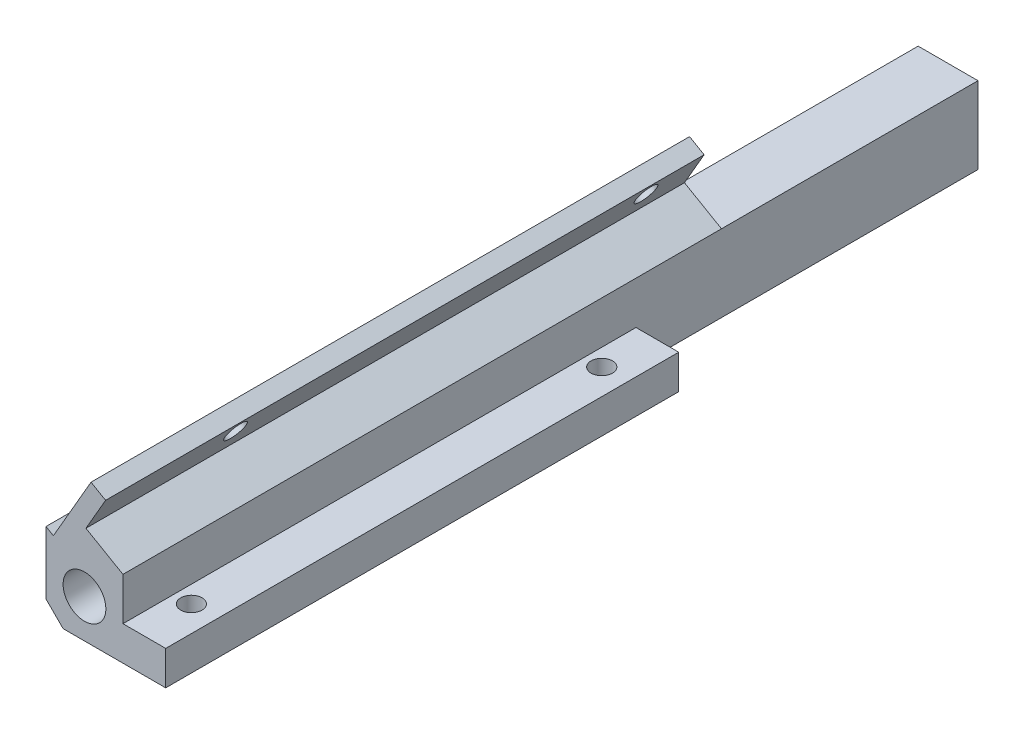
from build123d import *

# Parameters (mm, degrees)
SKETCH1_W           = 77.47
SKETCH1_H           = 127
BOSS_EXTRUDE1_DEPTH = 11.43
SKETCH2_R           = 3.175
CUT_EXTRUDE1_DEPTH  = 150.202030147
CUT_EXTRUDE2_DEPTH  = 150.202030147
SKETCH4_W           = 54.61
SKETCH4_H           = 6.35
CUT_EXTRUDE3_DEPTH  = 150.202030147
CHAMFER1_SIZE       = 2.54
CUT_EXTRUDE4_DEPTH  = 150.202030147
SKETCH6_W           = 53.34
SKETCH6_H           = 76.2
CUT_EXTRUDE5_DEPTH  = 150.202030147
SKETCH7_R           = 1.5875
CUT_EXTRUDE6_DEPTH  = 130.427892666
BOSS_EXTRUDE5_DEPTH = 88.9
SKETCH18_W          = 6.35
SKETCH18_H          = 5.08
CUT_EXTRUDE13_DEPTH = 76.2
CUT_EXTRUDE15_REACH = 132.131
SKETCH19_R          = 1.5875
SKETCH20_W          = 88.9
SKETCH20_H          = 11.176
CUT_EXTRUDE16_DEPTH = 1.27


with BuildPart() as part:
    # Sketch1 → Boss-Extrude1 (new body)
    with BuildSketch(Plane(origin=(0, 0, 0), x_dir=(1, 0, 0), z_dir=(0, 1, 0))):
        with Locations((38.735, 63.5)):
            Rectangle(SKETCH1_W, SKETCH1_H)
    extrude(amount=BOSS_EXTRUDE1_DEPTH)

    # Sketch2 → Cut-Extrude1 (cut, through all)
    with BuildSketch(Plane.XY):
        with Locations((5.715, 5.715)):
            Circle(SKETCH2_R)
        with Locations((71.755, 5.715)):
            Circle(SKETCH2_R)
    extrude(amount=-CUT_EXTRUDE1_DEPTH, mode=Mode.SUBTRACT)

    # Sketch3 → Cut-Extrude2 (cut, through all)
    with BuildSketch(Plane(origin=(0, 11.43, 0), x_dir=(1, 0, 0), z_dir=(0, 1, 0))):
        with BuildLine():
            Line((11.43, 127), (11.43, 88.9))
            ThreePointArc((11.43, 88.9), (15.149743879, 79.919743879), (24.13, 76.2))
            Line((24.13, 76.2), (53.34, 76.2))
            ThreePointArc((53.34, 76.2), (62.320256121, 79.919743879), (66.04, 88.9))
            Line((66.04, 88.9), (66.04, 127))
            Line((66.04, 127), (11.43, 127))
        make_face()
    extrude(amount=-CUT_EXTRUDE2_DEPTH, mode=Mode.SUBTRACT)

    # Sketch4 → Cut-Extrude3 (cut, through all)
    with BuildSketch(Plane(origin=(0, 0, -127), x_dir=(-1, 0, 0), z_dir=(0, 0, -1))):
        with Locations((-38.735, 8.255)):
            Rectangle(SKETCH4_W, SKETCH4_H)
    extrude(amount=-CUT_EXTRUDE3_DEPTH, mode=Mode.SUBTRACT)

    # Chamfer1
    chamfer1_edges = [part.edges().sort_by_distance(p)[0] for p in [
        (0, 0, -63.5),
        (0, 11.43, -63.5),
        (77.47, 0, -63.5),
        (77.47, 11.43, -63.5),
    ]]
    chamfer(chamfer1_edges, length=CHAMFER1_SIZE)

    # Sketch5 → Cut-Extrude4 (cut, through all)
    with BuildSketch(Plane(origin=(0, 11.43, 0), x_dir=(1, 0, 0), z_dir=(0, 1, 0))):
        Polygon((11.43, 88.9), (11.43, 76.2), (77.47, 76.2), (77.47, 127), (11.43, 127), align=None)
    extrude(amount=-CUT_EXTRUDE4_DEPTH, mode=Mode.SUBTRACT)

    # Sketch6 → Cut-Extrude5 (cut, through all)
    with BuildSketch(Plane(origin=(0, 11.43, 0), x_dir=(1, 0, 0), z_dir=(0, 1, 0))):
        with Locations((50.8, 38.1)):
            Rectangle(SKETCH6_W, SKETCH6_H)
    extrude(amount=-CUT_EXTRUDE5_DEPTH, mode=Mode.SUBTRACT)

    # Sketch7 → Cut-Extrude6 (cut, through all)
    with BuildSketch(Plane(origin=(0, 5.08, 0), x_dir=(1, 0, 0), z_dir=(0, 1, 0))):
        with Locations((13.97, 68.58)):
            Circle(SKETCH7_R)
        with Locations((13.97, 7.62)):
            Circle(SKETCH7_R)
    extrude(amount=-CUT_EXTRUDE6_DEPTH, mode=Mode.SUBTRACT)

    # Sketch17 → Boss-Extrude5 (add)
    with BuildSketch(Plane.XY):
        Polygon((0, 8.89), (0, 11.869940905), (5.588, 21.548640818), (8.851738686, 19.664320409), (5.930738686, 14.605), (11.43, 11.43), (2.54, 11.43), align=None)
    extrude(amount=-BOSS_EXTRUDE5_DEPTH)

    # Sketch18 → Cut-Extrude13 (cut)
    with BuildSketch(Plane.XY):
        with Locations((20.955, 2.54)):
            Rectangle(SKETCH18_W, SKETCH18_H)
    extrude(amount=-CUT_EXTRUDE13_DEPTH, mode=Mode.SUBTRACT)

    # Sketch19 → Cut-Extrude15 (cut, up to next)
    with BuildSketch(Plane(origin=(-1.876096497, 1.083164817, 0), x_dir=(0, 0, -1), z_dir=(0.8660254037844363, -0.5000000000000043, 0)), mode=Mode.PRIVATE) as cut_extrude15_sk1:
        with Locations((20.32, 19.423670365)):
            Circle(SKETCH19_R)
    cut_extrude15_tool1 = extrude(cut_extrude15_sk1.sketch, amount=-CUT_EXTRUDE15_REACH, mode=Mode.PRIVATE) & part.part
    # Sketch19 → Cut-Extrude15 (cut, up to next)
    with BuildSketch(Plane(origin=(-1.876096497, 1.083164817, 0), x_dir=(0, 0, -1), z_dir=(0.8660254037844363, -0.5000000000000043, 0)), mode=Mode.PRIVATE) as cut_extrude15_sk2:
        with Locations((81.28, 19.423670365)):
            Circle(SKETCH19_R)
    cut_extrude15_tool2 = extrude(cut_extrude15_sk2.sketch, amount=-CUT_EXTRUDE15_REACH, mode=Mode.PRIVATE) & part.part
    add(cut_extrude15_tool1.solids().sort_by_distance((7.835739, 17.904557, -20.32))[0], mode=Mode.SUBTRACT)
    add(cut_extrude15_tool2.solids().sort_by_distance((7.835739, 17.904557, -81.28))[0], mode=Mode.SUBTRACT)

    # Sketch20 → Cut-Extrude16 (cut)
    with BuildSketch(Plane(origin=(-5.139835183, 2.967485226, 0), x_dir=(0, 0, 1), z_dir=(-0.8660254037844363, 0.5000000000000043, 0))):
        with Locations((-44.45, 15.867670365)):
            Rectangle(SKETCH20_W, SKETCH20_H)
    extrude(amount=-CUT_EXTRUDE16_DEPTH, mode=Mode.SUBTRACT)


solid = part.part
